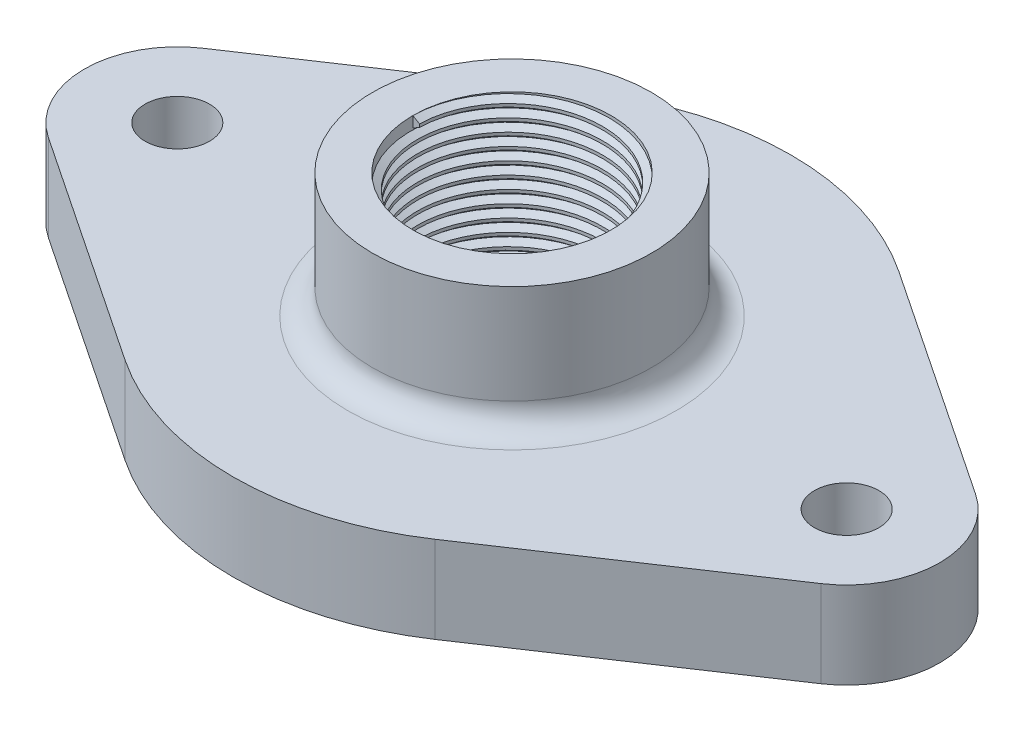
from build123d import *

# Parameters (mm, degrees)
IZIM1_R                     = 2.6
Y_KSEKLIK_EKSTR_ZYON1_DEPTH = 7
IZIM3_R                     = 11.25
IZIM3_R_2                   = 8
Y_KSEKLIK_EKSTR_ZYON2_DEPTH = 10
KES_EKSTR_ZYON1_START       = -5
IZIM4_R                     = 8
KES_EKSTR_ZYON1_DEPTH       = 5
DI_1_PITCH                  = 1
RADYUS1_R                   = 2


with BuildPart() as part:
    # Çizim1 → Yükseklik-Ekstrüzyon1 (new body)
    with BuildSketch(Plane(origin=(0, 0, 0), x_dir=(1, 0, 0), z_dir=(0, 1, 0))):
        with BuildLine():
            Line((-31.166666667, 6.236095645), (-12.5, 18.708286934))
            ThreePointArc((-12.5, 18.708286934), (0, 22.5), (12.5, 18.708286934))
            Line((12.5, 18.708286934), (31.166666667, 6.236095645))
            ThreePointArc((31.166666667, 6.236095645), (34.5, 0), (31.166666667, -6.236095645))
            Line((31.166666667, -6.236095645), (12.5, -18.708286934))
            ThreePointArc((12.5, -18.708286934), (0, -22.5), (-12.5, -18.708286934))
            Line((-12.5, -18.708286934), (-31.166666667, -6.236095645))
            ThreePointArc((-31.166666667, -6.236095645), (-34.5, 0), (-31.166666667, 6.236095645))
        make_face()
        with Locations(Location((-27, 0, 0), (0, 0, 270))):
            Circle(IZIM1_R, mode=Mode.SUBTRACT)
        with Locations(Location((27, 0, 0), (0, 0, 270))):
            Circle(IZIM1_R, mode=Mode.SUBTRACT)
    extrude(amount=Y_KSEKLIK_EKSTR_ZYON1_DEPTH)

    # Çizim3 → Yükseklik-Ekstrüzyon2 (add)
    with BuildSketch(Plane(origin=(0, 7, 0), x_dir=(1, 0, 0), z_dir=(0, 1, 0))):
        with Locations(Location((0, 0, 0), (0, 0, 270))):
            Circle(IZIM3_R)
        with Locations(Location((0, 0, 0), (0, 0, 270))):
            Circle(IZIM3_R_2, mode=Mode.SUBTRACT)
    extrude(amount=Y_KSEKLIK_EKSTR_ZYON2_DEPTH)

    # Çizim4 → Kes-Ekstrüzyon1 (cut)
    with BuildSketch(Plane(origin=(0, 7, 0), x_dir=(1, 0, 0), z_dir=(0, 1, 0)).offset(KES_EKSTR_ZYON1_START)):
        with Locations(Location((0, 0, 0), (0, 0, 270))):
            Circle(IZIM4_R)
    extrude(amount=KES_EKSTR_ZYON1_DEPTH, mode=Mode.SUBTRACT)

    # Diş1: the profile of Diş Profili1 profile screwed along a right-hand helix of 15 turns, 8 arcs to a turn; built about Z, then put on its axis
    di_1_z = Axis((0, 0, 0), (0, 0, 1))
    di_1_corners = [(8.0003, 0, -0.000173205), (8.0003, 0, 0.875173202), (7.458734125, 0, 0.562499999), (7.458734125, 0, 0.312499999)]
    with BuildLine(mode=Mode.PRIVATE) as di_1_profile:
        Line(di_1_corners[0], di_1_corners[1])
        Line(di_1_corners[1], di_1_corners[2])
        Line(di_1_corners[2], di_1_corners[3])
        Line(di_1_corners[3], di_1_corners[0])
    di_1_cap = Face(di_1_profile.wire())
    di_1_turn_angles = [0, 22.5, 45, 67.5, 90, 112.5, 135, 157.5, 180, 202.5, 225, 247.5, 270, 292.5, 315, 337.5, 360]
    di_1_turn_weights = [1, 0.9238795325112867, 1, 0.9238795325112867, 1, 0.9238795325112867, 1, 0.9238795325112867, 1, 0.9238795325112867, 1, 0.9238795325112867, 1, 0.9238795325112867, 1, 0.9238795325112867, 1]
    di_1_turn_rails = [Edge.make_bspline([Vector(p[0], p[1], 0).rotate(di_1_z, di_1_turn_angles[k]) / di_1_turn_weights[k] + Vector(0, 0, p[2] + DI_1_PITCH * di_1_turn_angles[k] / 360) for k in range(17)], [0, 0, 0, 1, 1, 2, 2, 3, 3, 4, 4, 5, 5, 6, 6, 7, 7, 8, 8, 8], 2, di_1_turn_weights) for p in di_1_corners]
    di_1_turn_sides = [Face.make_surface_from_curves(di_1_turn_rails[p[0]], di_1_turn_rails[p[1]]) for p in [(0, 1), (1, 2), (2, 3), (3, 0)]]
    di_1 = Plane(origin=(0, 17, 0), x_dir=(-1, 0, 0), z_dir=(0, -1, 0)) * Solid(Shell([*[p.moved(Location((0, 0, DI_1_PITCH * i))) for i in range(15) for p in di_1_turn_sides], di_1_cap, di_1_cap.rotate(di_1_z, 5400).moved(Location((0, 0, DI_1_PITCH * 5400 / 360)))]))
    add(di_1)

    # Radyus1
    radyus1_edges = [part.edges().sort_by_distance(p)[0] for p in [
        (0, 7, -11.25),
    ]]
    fillet(radyus1_edges, radius=RADYUS1_R)


solid = part.part
